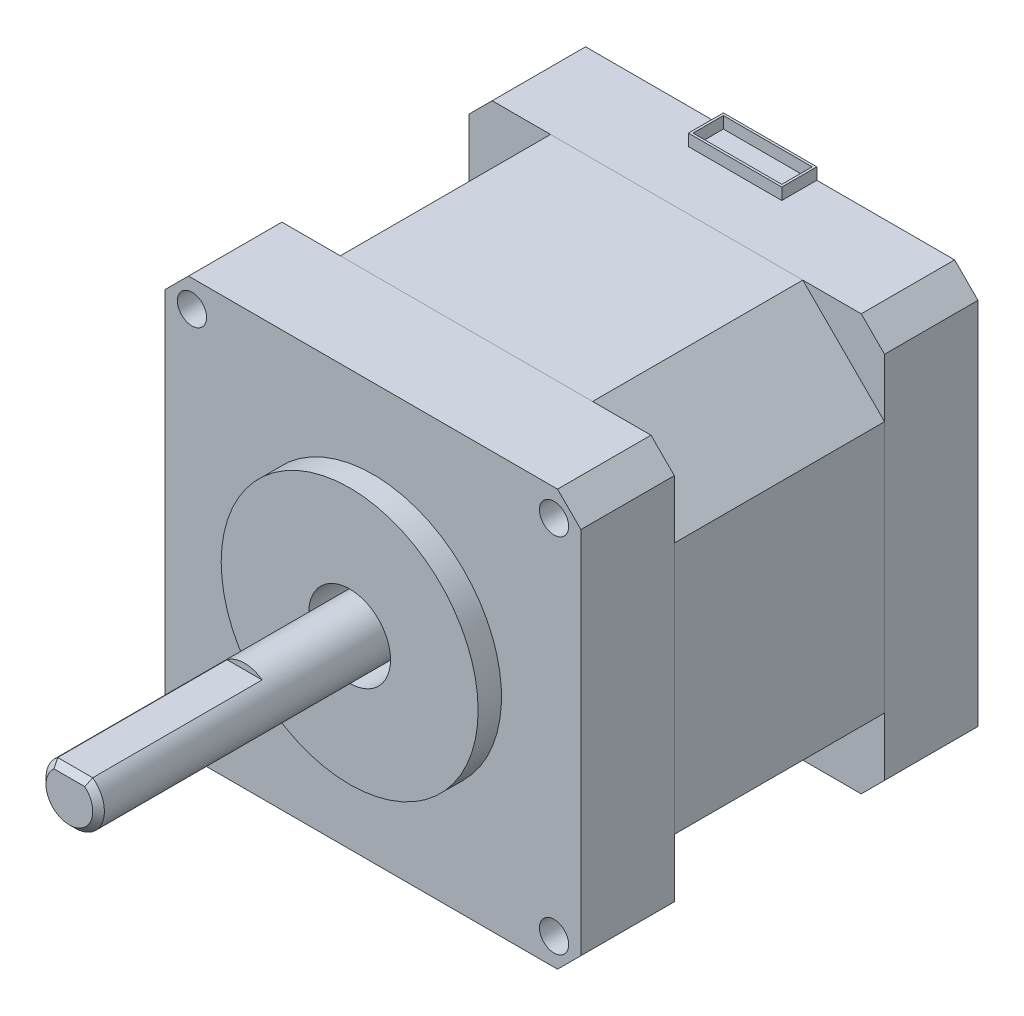
from build123d import *

# Parameters (mm, degrees)
BOSS_EXTRUDE1_DEPTH         = 8
BOSS_EXTRUDE2_DEPTH         = 18
TAP_DRILL_FOR_M3_TAP1_D     = 2.5
TAP_DRILL_FOR_M3_TAP1_DEPTH = 3.5
TAP_DRILL_FOR_M3_TAP1_TIP   = 0.751075774
SKETCH6_R                   = 11
BOSS_EXTRUDE3_DEPTH         = 2
SKETCH7_R                   = 3.5
CUT_EXTRUDE1_DEPTH          = 5
SKETCH8_R                   = 2.5
BOSS_EXTRUDE4_DEPTH         = 29
SKETCH9_W                   = 5
SKETCH9_H                   = 2
CUT_EXTRUDE2_DEPTH          = 15
CHAMFER1_SIZE               = 0.5
CUT_EXTRUDE3_START          = -3
SKETCH10_R                  = 3.5
CUT_EXTRUDE3_DEPTH          = 3
BOSS_EXTRUDE5_START         = 3
SKETCH11_R                  = 2.5
BOSS_EXTRUDE5_DEPTH         = 3
CHAMFER2_SIZE               = 0.5
SKETCH12_W                  = 8
SKETCH12_H                  = 3
SKETCH12_W_2                = 7.6
SKETCH12_H_2                = 2.6
BOSS_EXTRUDE6_DEPTH         = 1
SPLIT1_START                = 8
SPLIT1_DEPTH                = 52
SPLIT1_2_DEPTH              = 18
SPLIT1_START_2              = 26
SPLIT1_3_OUTLINE_R          = 3.5
SPLIT1_3_OUTLINE_R_2        = 1.25
SPLIT1_3_OUTLINE_R_3        = 2.5
SPLIT1_3_DEPTH              = 8
SPLIT1_START_3              = 34
SPLIT1_4_OUTLINE_R          = 11
SPLIT1_4_OUTLINE_R_2        = 3.5
SPLIT1_4_OUTLINE_R_3        = 2.5
SPLIT1_4_DEPTH              = 2
SPLIT1_START_4              = 36
SPLIT1_5_DEPTH              = 24
SPLIT1_6_OUTLINE_R          = 1.25
SPLIT1_6_OUTLINE_R_2        = 3.5
SPLIT1_6_OUTLINE_R_3        = 2.5
SPLIT1_6_DEPTH              = 4.4999999
SPLIT1_START_5              = 29.748924126
SPLIT1_7_OUTLINE_R          = 3.5
SPLIT1_7_OUTLINE_R_2        = 2.5
SPLIT1_7_DEPTH              = 1.251075874
SPLIT1_8_DEPTH              = 9
SPLIT1_START_6              = 43.487067043
SPLIT1_10_OUTLINE_W         = 6
SPLIT1_10_OUTLINE_H         = 4
SPLIT1_10_DEPTH             = 1.512932957


with BuildPart() as part:
    # Sketch1 → Boss-Extrude1 (new body)
    with BuildSketch(Plane.XY):
        Polygon((-17.8, 15.8), (-15.8, 17.8), (15.8, 17.8), (17.8, 15.8), (17.8, -15.8), (15.8, -17.8), (-15.8, -17.8), (-17.8, -15.8), align=None)
    boss_extrude1 = extrude(amount=BOSS_EXTRUDE1_DEPTH)

    # Sketch2 → Boss-Extrude2 (add)
    with BuildSketch(Plane.XY.offset(8)):
        Polygon((10.8, -17.8), (-10.8, -17.8), (-17.8, -10.8), (-17.8, 10.8), (-10.8, 17.8), (10.8, 17.8), (17.8, 10.8), (17.8, -10.8), align=None)
    extrude(amount=BOSS_EXTRUDE2_DEPTH)

    # Mirror1: Boss-Extrude1 across plane
    add(boss_extrude1.mirror(Plane.XY.offset(17)))

    # Tap Drill for M3 Tap1
    with Locations(Plane.XY.offset(34)):
        with Locations((-15.5, 15.5), (15.5, 15.5), (15.5, -15.5), (-15.5, -15.5)):
            Hole(TAP_DRILL_FOR_M3_TAP1_D / 2, depth=TAP_DRILL_FOR_M3_TAP1_DEPTH)
            with Locations((0, 0, -(TAP_DRILL_FOR_M3_TAP1_DEPTH + TAP_DRILL_FOR_M3_TAP1_TIP / 2))):  # 118° drill point
                Cone(0, TAP_DRILL_FOR_M3_TAP1_D / 2, TAP_DRILL_FOR_M3_TAP1_TIP, mode=Mode.SUBTRACT)

    # Sketch6 → Boss-Extrude3 (add)
    with BuildSketch(Plane.XY.offset(34)):
        with Locations(Location((0, 0, 0), (0, 0, 180))):
            Circle(SKETCH6_R)
    extrude(amount=BOSS_EXTRUDE3_DEPTH)

    # Sketch7 → Cut-Extrude1 (cut)
    with BuildSketch(Plane.XY.offset(36)):
        Circle(SKETCH7_R)
    extrude(amount=-CUT_EXTRUDE1_DEPTH, mode=Mode.SUBTRACT)

    # Sketch8 → Boss-Extrude4 (add)
    with BuildSketch(Plane.XY.offset(31)):
        with Locations(Location((0, 0, 0), (0, 0, 180))):
            Circle(SKETCH8_R)
    extrude(amount=BOSS_EXTRUDE4_DEPTH)

    # Sketch9 → Cut-Extrude2 (cut)
    with BuildSketch(Plane.XY.offset(60)):
        with Locations((0, 3)):
            Rectangle(SKETCH9_W, SKETCH9_H)
    extrude(amount=-CUT_EXTRUDE2_DEPTH, mode=Mode.SUBTRACT)

    # Chamfer1
    chamfer1_edges = [part.edges().sort_by_distance(p)[0] for p in [
        (1.118033989, -2.236067977, 60),
        (0, 2, 60),
    ]]
    chamfer(chamfer1_edges, length=CHAMFER1_SIZE - 0.0001)  # a hair under: the kernel refuses the full size

    # Sketch10 → Cut-Extrude3 (cut)
    with BuildSketch(Plane(origin=(0, 0, 0), x_dir=(-1, 0, 0), z_dir=(0, 0, -1)).offset(CUT_EXTRUDE3_START)):
        with Locations(Location((0, 0, 0), (0, 0, 180))):
            Circle(SKETCH10_R)
    extrude(amount=CUT_EXTRUDE3_DEPTH, mode=Mode.SUBTRACT)

    # Sketch11 → Boss-Extrude5 (add)
    with BuildSketch(Plane(origin=(0, 0, 3), x_dir=(-1, 0, 0), z_dir=(0, 0, -1)).offset(BOSS_EXTRUDE5_START)):
        with Locations(Location((0, 0, 0), (0, 0, 53.130102354))):
            Circle(SKETCH11_R)
    extrude(amount=-BOSS_EXTRUDE5_DEPTH)

    # Chamfer2
    chamfer2_edges = [part.edges().sort_by_distance(p)[0] for p in [
        (1.5, -2, 0),
    ]]
    chamfer(chamfer2_edges, length=CHAMFER2_SIZE)

    # Sketch12 → Boss-Extrude6 (add)
    with BuildSketch(Plane(origin=(0, 17.8, 0), x_dir=(1, 0, 0), z_dir=(0, 1, 0))):
        with Locations((0, -1.5)):
            Rectangle(SKETCH12_W, SKETCH12_H)
        with Locations((0, -1.5)):
            Rectangle(SKETCH12_W_2, SKETCH12_H_2, mode=Mode.SUBTRACT)
    extrude(amount=BOSS_EXTRUDE6_DEPTH)

    # Split1: read off the stored shape, not the designer's step
    # Split1 outline → Split1 (cut)
    with BuildSketch(Plane.XY.offset(SPLIT1_START)):
        Polygon((-15.8, 17.8), (-17.8, 15.8), (-17.8, -15.8), (-15.8, -17.8), (15.8, -17.8), (17.8, -15.8), (17.8, 15.8), (15.8, 17.8), align=None)
    extrude(amount=SPLIT1_DEPTH, mode=Mode.SUBTRACT)


with BuildPart() as body_2:
    # Split1 2 outline → Split1 2 (new body)
    with BuildSketch(Plane.XY.offset(SPLIT1_START)):
        Polygon((-17.8, 10.8), (-17.8, -10.8), (-10.8, -17.8), (10.8, -17.8), (17.8, -10.8), (17.8, 10.8), (10.8, 17.8), (-10.8, 17.8), align=None)
    extrude(amount=SPLIT1_2_DEPTH)


with BuildPart() as body_3:
    # Split1 3 outline → Split1 3 (new body)
    # profile 1 of 2: a face of its own
    with BuildSketch(Plane.XY.offset(SPLIT1_START_2)):
        Polygon((-15.8, -17.8), (15.8, -17.8), (17.8, -15.8), (17.8, 15.8), (15.8, 17.8), (-15.8, 17.8), (-17.8, 15.8), (-17.8, -15.8), align=None)
        Circle(SPLIT1_3_OUTLINE_R, mode=Mode.SUBTRACT)
        with Locations((-15.5, -15.5)):
            Circle(SPLIT1_3_OUTLINE_R_2, mode=Mode.SUBTRACT)
        with Locations((15.5, -15.5)):
            Circle(SPLIT1_3_OUTLINE_R_2, mode=Mode.SUBTRACT)
        with Locations((-15.5, 15.5)):
            Circle(SPLIT1_3_OUTLINE_R_2, mode=Mode.SUBTRACT)
        with Locations((15.5, 15.5)):
            Circle(SPLIT1_3_OUTLINE_R_2, mode=Mode.SUBTRACT)
    # profile 2 of 2: a face of its own
    with BuildSketch(Plane.XY.offset(SPLIT1_START_2)):
        Circle(SPLIT1_3_OUTLINE_R_3)
    extrude(amount=SPLIT1_3_DEPTH)

    # Split1 4 outline → Split1 4 (add)
    # profile 1 of 2: a face of its own
    with BuildSketch(Plane.XY.offset(SPLIT1_START_3)):
        Circle(SPLIT1_4_OUTLINE_R)
        Circle(SPLIT1_4_OUTLINE_R_2, mode=Mode.SUBTRACT)
    # profile 2 of 2: a face of its own
    with BuildSketch(Plane.XY.offset(SPLIT1_START_3)):
        Circle(SPLIT1_4_OUTLINE_R_3)
    extrude(amount=SPLIT1_4_DEPTH)

    # Split1 5 outline → Split1 5 (add)
    with BuildSketch(Plane.XY.offset(SPLIT1_START_4)):
        with BuildLine():
            Line((1.5, 2), (-1.5, 2))
            ThreePointArc((-1.5, 2), (0, -2.5), (1.5, 2))
        make_face()
    extrude(amount=SPLIT1_5_DEPTH)

    # Split1 6 outline → Split1 6 (add)
    # profile 1 of 5: a face of its own
    with BuildSketch(Plane.XY.offset(SPLIT1_START_2)):
        with Locations((-15.5, -15.5)):
            Circle(SPLIT1_6_OUTLINE_R)
    # profile 2 of 5: a face of its own
    with BuildSketch(Plane.XY.offset(SPLIT1_START_2)):
        with Locations((15.5, -15.5)):
            Circle(SPLIT1_6_OUTLINE_R)
    # profile 3 of 5: a face of its own
    with BuildSketch(Plane.XY.offset(SPLIT1_START_2)):
        with Locations((15.5, 15.5)):
            Circle(SPLIT1_6_OUTLINE_R)
    # profile 4 of 5: a face of its own
    with BuildSketch(Plane.XY.offset(SPLIT1_START_2)):
        with Locations((-15.5, 15.5)):
            Circle(SPLIT1_6_OUTLINE_R)
    # profile 5 of 5: a face of its own
    with BuildSketch(Plane.XY.offset(SPLIT1_START_2)):
        Circle(SPLIT1_6_OUTLINE_R_2)
        Circle(SPLIT1_6_OUTLINE_R_3, mode=Mode.SUBTRACT)
    extrude(amount=SPLIT1_6_DEPTH)

    # Split1 7 outline → Split1 7 (add)
    with BuildSketch(Plane.XY.offset(SPLIT1_START_5)):
        Circle(SPLIT1_7_OUTLINE_R)
        Circle(SPLIT1_7_OUTLINE_R_2, mode=Mode.SUBTRACT)
    extrude(amount=SPLIT1_7_DEPTH)

    # Split1 8 outline → Split1 8 (add)
    with BuildSketch(Plane.XY.offset(SPLIT1_START_4)):
        with BuildLine():
            ThreePointArc((1.5, 2), (0, 2.5), (-1.5, 2))
            Line((-1.5, 2), (1.5, 2))
        make_face()
    extrude(amount=SPLIT1_8_DEPTH)

    # Split1 9 outline → Split1 9 (revolve, cut)
    with BuildSketch(Plane.XZ):
        Polygon((2.5, 60), (2, 60), (2.5, 59.5), align=None)
    revolve(axis=Axis((0, 0, 0), (0, 0, 1)), mode=Mode.SUBTRACT)

    # Split1 10 outline → Split1 10 (cut)
    with BuildSketch(Plane(origin=(0, 0, 0), x_dir=(1, 0, 0), z_dir=(0, 0.707106781186543, 0.707106781186552)).offset(SPLIT1_START_6)):
        with Locations((0, -41)):
            Rectangle(SPLIT1_10_OUTLINE_W, SPLIT1_10_OUTLINE_H)
    extrude(amount=SPLIT1_10_DEPTH, mode=Mode.SUBTRACT)

    # Split1 11 outline → Split1 11 (revolve, cut)
    with BuildSketch(Plane(origin=(-15.5, -15.5, 0), x_dir=(1, 0, 0), z_dir=(0, -1, 0))):
        Polygon((0, 30.5), (0, 29.748924226), (1.25, 30.5), align=None)
    revolve(axis=Axis((-15.5, -15.5, 0), (0, 0, 1)), mode=Mode.SUBTRACT)

    # Split1 12 outline → Split1 12 (revolve, cut)
    with BuildSketch(Plane(origin=(15.5, -15.5, 0), x_dir=(1, 0, 0), z_dir=(0, -1, 0))):
        Polygon((0, 30.5), (0, 29.748924226), (1.25, 30.5), align=None)
    revolve(axis=Axis((15.5, -15.5, 0), (0, 0, 1)), mode=Mode.SUBTRACT)

    # Split1 13 outline → Split1 13 (revolve, cut)
    with BuildSketch(Plane(origin=(15.5, 15.5, 0), x_dir=(1, 0, 0), z_dir=(0, -1, 0))):
        Polygon((0, 30.5), (0, 29.748924226), (1.25, 30.5), align=None)
    revolve(axis=Axis((15.5, 15.5, 0), (0, 0, 1)), mode=Mode.SUBTRACT)

    # Split1 14 outline → Split1 14 (revolve, cut)
    with BuildSketch(Plane(origin=(-15.5, 15.5, 0), x_dir=(1, 0, 0), z_dir=(0, -1, 0))):
        Polygon((0, 30.5), (0, 29.748924226), (1.25, 30.5), align=None)
    revolve(axis=Axis((-15.5, 15.5, 0), (0, 0, 1)), mode=Mode.SUBTRACT)


solid = Compound([part.part, body_2.part, body_3.part])
